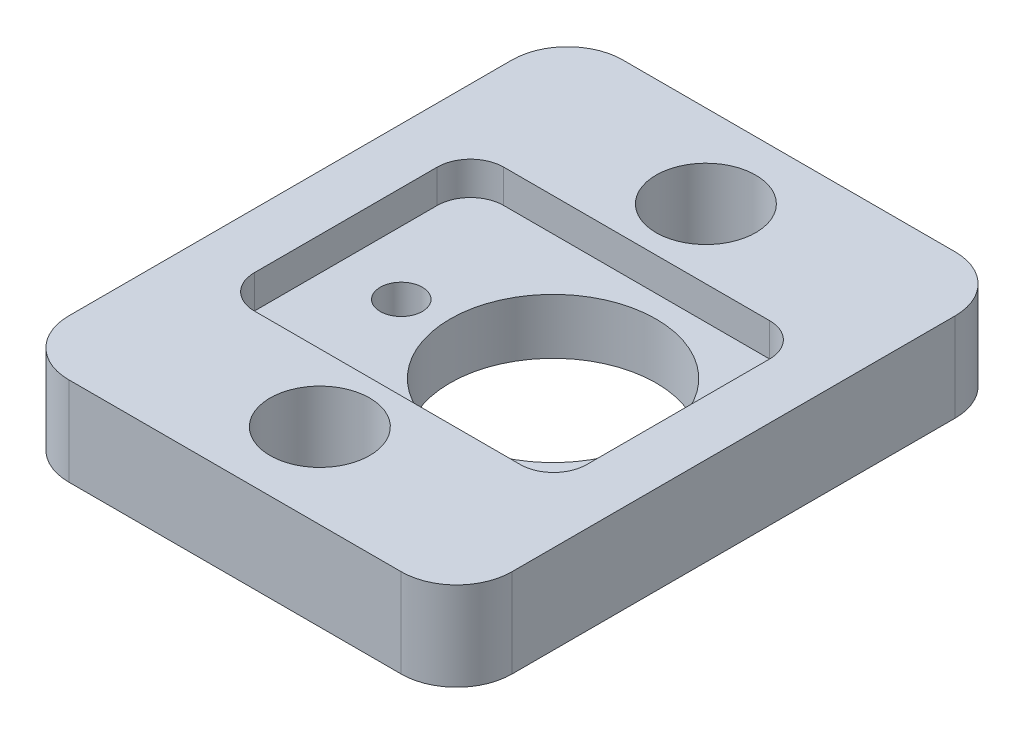
from build123d import *

# Parameters (mm, degrees)
BOSS_EXTRUDE1_DEPTH = 3.2
CUT_EXTRUDE1_DEPTH  = 1.2
SKETCH3_R           = 3.72
CUT_EXTRUDE2_DEPTH  = 26.690465157
SKETCH4_R           = 1.8
CUT_EXTRUDE3_DEPTH  = 26.811625288
SKETCH5_R           = 0.76
CUT_EXTRUDE4_DEPTH  = 10


with BuildPart() as part:
    # Sketch1 → Boss-Extrude1 (new body)
    with BuildSketch(Plane(origin=(0, 0, 0), x_dir=(1, 0, 0), z_dir=(0, 1, 0))):
        with BuildLine():
            Line((2, 0), (14, 0))
            ThreePointArc((14, 0), (15.414213562, -0.585786438), (16, -2))
            Line((16, -2), (16, -18))
            ThreePointArc((16, -18), (15.414213562, -19.414213562), (14, -20))
            Line((14, -20), (2, -20))
            ThreePointArc((2, -20), (0.585786438, -19.414213562), (0, -18))
            Line((0, -18), (0, -2))
            ThreePointArc((0, -2), (0.585786438, -0.585786438), (2, 0))
        make_face()
    extrude(amount=BOSS_EXTRUDE1_DEPTH)

    # Sketch2 → Cut-Extrude1 (cut)
    with BuildSketch(Plane(origin=(0, 3.2, 0), x_dir=(1, 0, 0), z_dir=(0, 1, 0))):
        with BuildLine():
            Line((3.2, -5.5), (12.8, -5.5))
            ThreePointArc((12.8, -5.5), (13.648528137, -5.851471863), (14, -6.7))
            Line((14, -6.7), (14, -13.3))
            ThreePointArc((14, -13.3), (13.648528137, -14.148528137), (12.8, -14.5))
            Line((12.8, -14.5), (3.2, -14.5))
            ThreePointArc((3.2, -14.5), (2.351471863, -14.148528137), (2, -13.3))
            Line((2, -13.3), (2, -6.7))
            ThreePointArc((2, -6.7), (2.351471863, -5.851471863), (3.2, -5.5))
        make_face()
    extrude(amount=-CUT_EXTRUDE1_DEPTH, mode=Mode.SUBTRACT)

    # Sketch3 → Cut-Extrude2 (cut, through all)
    with BuildSketch(Plane(origin=(0, 2, 0), x_dir=(1, 0, 0), z_dir=(0, 1, 0))):
        with Locations((9.5, -10.0173545)):
            Circle(SKETCH3_R)
    extrude(amount=-CUT_EXTRUDE2_DEPTH, mode=Mode.SUBTRACT)

    # Sketch4 → Cut-Extrude3 (cut, through all)
    with BuildSketch(Plane(origin=(0, 3.2, 0), x_dir=(1, 0, 0), z_dir=(0, 1, 0))):
        with Locations((8, -3)):
            Circle(SKETCH4_R)
        with Locations((8, -16.936566923)):
            Circle(SKETCH4_R)
    extrude(amount=-CUT_EXTRUDE3_DEPTH, mode=Mode.SUBTRACT)

    # Sketch5 → Cut-Extrude4 (cut)
    with BuildSketch(Plane(origin=(0, 2, 0), x_dir=(1, 0, 0), z_dir=(0, 1, 0))):
        with Locations((4.286808808, -10.283883288)):
            Circle(SKETCH5_R)
    extrude(amount=-CUT_EXTRUDE4_DEPTH, mode=Mode.SUBTRACT)


solid = part.part
